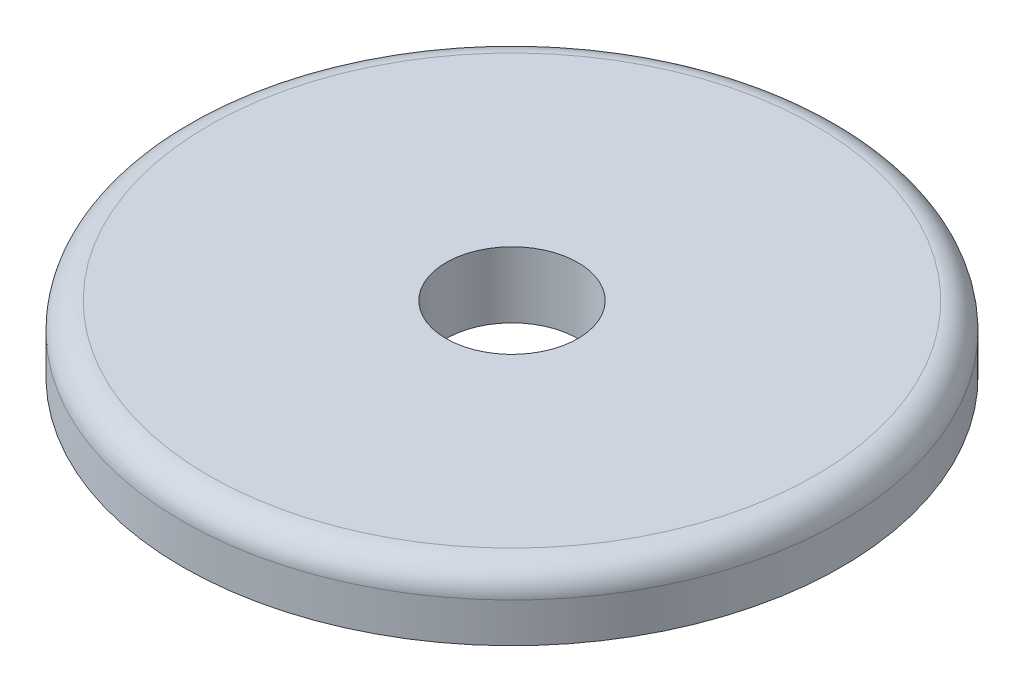
from build123d import *

# Parameters (mm, degrees)
SKETCH2_R           = 63.5
SKETCH2_R_2         = 12.7
BOSS_EXTRUDE1_DEPTH = 12.7
FILLET1_R           = 5.08


with BuildPart() as part:
    # Sketch2 → Boss-Extrude1 (new body)
    with BuildSketch(Plane(origin=(0, 0, 0), x_dir=(1, 0, 0), z_dir=(0, 1, 0))):
        Circle(SKETCH2_R)
        Circle(SKETCH2_R_2, mode=Mode.SUBTRACT)
    extrude(amount=BOSS_EXTRUDE1_DEPTH)

    # Fillet1
    fillet1_edges = [part.edges().sort_by_distance(p)[0] for p in [
        (-63.5, 12.7, 0),
    ]]
    fillet(fillet1_edges, radius=FILLET1_R)


solid = part.part
